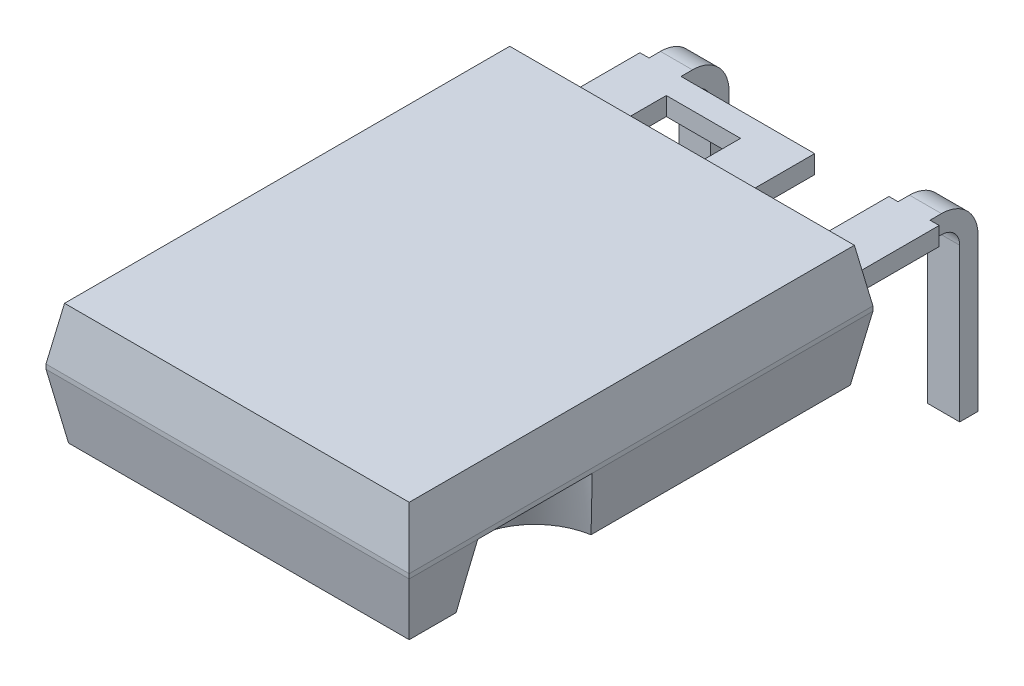
from build123d import *

# Parameters (mm, degrees)
SKETCH_3_W          = 15.9
SKETCH_3_H          = 5.3
EXTRUDE_1_DEPTH     = 20.3
SKETCH_4_W          = 2.2
SKETCH_4_H          = 0.8
EXTRUDE_2_DEPTH     = 4.3
SKETCH_6_W          = 1.4
SKETCH_6_H          = 0.8
EXTRUDE_3_DEPTH     = 10.5
SKETCH_7_R          = 1.8
CUT_EXTRUDE_1_DEPTH = 2.8
SKETCH_8_R          = 1
CUT_EXTRUDE_2_DEPTH = 0.1
CHAMFER_1_SIZE      = 2.8
CHAMFER_1_SIZE_2    = 0.493715546
CHAMFER_2_SIZE      = 0.405552056
CHAMFER_2_SIZE_2    = 2.3
SKETCH_9_W          = 1.4
SKETCH_9_H          = 0.8
CUT_EXTRUDE_3_DEPTH = 10.5
SKETCH_10_W         = 1.045125196
SKETCH_10_H         = 0.8
EXTRUDE_4_DEPTH     = 3.25
SKETCH_11_W         = 1.4
SKETCH_11_H         = 0.8
EXTRUDE_5_DEPTH     = 7.5
SKETCH_12_W         = 1.4
SKETCH_12_H         = 0.8
CUT_EXTRUDE_4_DEPTH = 8.4
FILLET_1_R          = 0.8
FILLET_2_R          = 1.6
SKETCH_13_R         = 0.177871301
CUT_EXTRUDE_5_DEPTH = 4


with BuildPart() as part:
    # Эскиз3 → Вытянуть1 (new body)
    with BuildSketch(Plane.XY.offset(4.3)):
        with Locations((0, -0.15)):
            Rectangle(SKETCH_3_W, SKETCH_3_H)
    extrude(amount=EXTRUDE_1_DEPTH)

    # Эскиз4 → Вытянуть2 (add)
    with BuildSketch(Plane.XY):
        Rectangle(SKETCH_4_W, SKETCH_4_H)
        with Locations((-5.45, 0)):
            Rectangle(SKETCH_4_W, SKETCH_4_H)
        with Locations((5.45, 0)):
            Rectangle(SKETCH_4_W, SKETCH_4_H)
    extrude(amount=EXTRUDE_2_DEPTH)

    # Эскиз6 → Вытянуть3 (add)
    with BuildSketch(Plane.XY):
        Rectangle(SKETCH_6_W, SKETCH_6_H)
        with Locations((-5.45, 0)):
            Rectangle(SKETCH_6_W, SKETCH_6_H)
        with Locations((5.45, 0)):
            Rectangle(SKETCH_6_W, SKETCH_6_H)
    extrude(amount=-EXTRUDE_3_DEPTH)

    # Эскиз7 → Вырез-Вытянуть1 (cut)
    with BuildSketch(Plane.XZ.offset(2.8)):
        with Locations((0, 19.1)):
            Circle(SKETCH_7_R)
        with BuildLine():
            Line((7.95, 16.6), (7.95, 21.6))
            ThreePointArc((7.95, 21.6), (5.45, 19.1), (7.95, 16.6))
        make_face()
        with BuildLine():
            Line((-7.95, 16.6), (-7.95, 21.6))
            ThreePointArc((-7.95, 21.6), (-5.45, 19.1), (-7.95, 16.6))
        make_face()
    extrude(amount=-CUT_EXTRUDE_1_DEPTH, mode=Mode.SUBTRACT)

    # Эскиз8 → Вырез-Вытянуть2 (cut)
    with BuildSketch(Plane.XZ.offset(2.8)):
        with Locations((-5, 7)):
            Circle(SKETCH_8_R)
    extrude(amount=-CUT_EXTRUDE_2_DEPTH, mode=Mode.SUBTRACT)

    # Фаска1
    # the kernel refuses this chamfer: 2.8, 0.493715546 mm, written as the material it takes off along each edge
    with BuildSketch(Plane(origin=(15.22590863, -2.8, 4.3), x_dir=(0, 0.9999776716360547, -0.006682531656101734), z_dir=(-1, 0, 0))) as chamfer_1_piece_1_section:
        Polygon((CHAMFER_1_SIZE * 0.999977671636, -CHAMFER_1_SIZE * 0.0066825316561), (-CHAMFER_1_SIZE_2 * 0.00668253165588, -CHAMFER_1_SIZE_2 * 0.999977671603), (0, 0), align=None)
    chamfer_1_piece_1 = extrude(amount=30.45181726, mode=Mode.PRIVATE)
    chamfer_1_piece_1 = split(chamfer_1_piece_1, bisect_by=Plane(origin=(6.55, -0.266666667, 4.323510264), z_dir=(1, 0, 0)), keep=Keep.TOP, mode=Mode.PRIVATE)
    add(chamfer_1_piece_1, mode=Mode.SUBTRACT)
    with BuildSketch(Plane(origin=(15.22590863, -2.8, 4.3), x_dir=(0, 0.9999776716360547, -0.006682531656101734), z_dir=(-1, 0, 0))) as chamfer_1_piece_2_section:
        Polygon((CHAMFER_1_SIZE * 0.999977671636, -CHAMFER_1_SIZE * 0.0066825316561), (-CHAMFER_1_SIZE_2 * 0.00668253165588, -CHAMFER_1_SIZE_2 * 0.999977671603), (0, 0), align=None)
    chamfer_1_piece_2 = extrude(amount=30.45181726, mode=Mode.PRIVATE)
    chamfer_1_piece_2 = split(chamfer_1_piece_2, bisect_by=Plane(origin=(5.45, -0.4, 4.467510632), z_dir=(0, -1, 0)), keep=Keep.TOP, mode=Mode.PRIVATE)
    add(chamfer_1_piece_2, mode=Mode.SUBTRACT)
    with BuildSketch(Plane(origin=(15.22590863, -2.8, 4.3), x_dir=(0, 0.9999776716360547, -0.006682531656101734), z_dir=(-1, 0, 0))) as chamfer_1_piece_3_section:
        Polygon((CHAMFER_1_SIZE * 0.999977671636, -CHAMFER_1_SIZE * 0.0066825316561), (-CHAMFER_1_SIZE_2 * 0.00668253165588, -CHAMFER_1_SIZE_2 * 0.999977671603), (0, 0), align=None)
    chamfer_1_piece_3 = extrude(amount=30.45181726, mode=Mode.PRIVATE)
    chamfer_1_piece_3 = split(chamfer_1_piece_3, bisect_by=Plane(origin=(4.35, -0.266666667, 4.323510264), z_dir=(-1, 0, 0)), keep=Keep.TOP, mode=Mode.PRIVATE)
    chamfer_1_piece_3 = split(chamfer_1_piece_3, bisect_by=Plane(origin=(1.1, -0.266666667, 4.323510264), z_dir=(1, 0, 0)), keep=Keep.TOP, mode=Mode.PRIVATE)
    add(chamfer_1_piece_3, mode=Mode.SUBTRACT)
    with BuildSketch(Plane(origin=(15.22590863, -2.8, 4.3), x_dir=(0, 0.9999776716360547, -0.006682531656101734), z_dir=(-1, 0, 0))) as chamfer_1_piece_4_section:
        Polygon((CHAMFER_1_SIZE * 0.999977671636, -CHAMFER_1_SIZE * 0.0066825316561), (-CHAMFER_1_SIZE_2 * 0.00668253165588, -CHAMFER_1_SIZE_2 * 0.999977671603), (0, 0), align=None)
    chamfer_1_piece_4 = extrude(amount=30.45181726, mode=Mode.PRIVATE)
    chamfer_1_piece_4 = split(chamfer_1_piece_4, bisect_by=Plane(origin=(-4.35, -0.266666667, 4.323510264), z_dir=(1, 0, 0)), keep=Keep.TOP, mode=Mode.PRIVATE)
    chamfer_1_piece_4 = split(chamfer_1_piece_4, bisect_by=Plane(origin=(-1.1, -0.266666667, 4.323510264), z_dir=(-1, 0, 0)), keep=Keep.TOP, mode=Mode.PRIVATE)
    add(chamfer_1_piece_4, mode=Mode.SUBTRACT)
    with BuildSketch(Plane(origin=(15.22590863, -2.8, 4.3), x_dir=(0, 0.9999776716360547, -0.006682531656101734), z_dir=(-1, 0, 0))) as chamfer_1_piece_5_section:
        Polygon((CHAMFER_1_SIZE * 0.999977671636, -CHAMFER_1_SIZE * 0.0066825316561), (-CHAMFER_1_SIZE_2 * 0.00668253165588, -CHAMFER_1_SIZE_2 * 0.999977671603), (0, 0), align=None)
    chamfer_1_piece_5 = extrude(amount=30.45181726, mode=Mode.PRIVATE)
    chamfer_1_piece_5 = split(chamfer_1_piece_5, bisect_by=Plane(origin=(-6.55, -0.266666667, 4.323510264), z_dir=(-1, 0, 0)), keep=Keep.TOP, mode=Mode.PRIVATE)
    add(chamfer_1_piece_5, mode=Mode.SUBTRACT)
    with BuildSketch(Plane(origin=(-7.95, -2.8, -2.97590863), x_dir=(-0.006682531656101734, 0.9999776716360547, 0), z_dir=(0, 0, 1))) as chamfer_1_piece_6:
        Polygon((CHAMFER_1_SIZE * 0.999977671636, -CHAMFER_1_SIZE * 0.0066825316561), (-CHAMFER_1_SIZE_2 * 0.00668253165588, -CHAMFER_1_SIZE_2 * 0.999977671603), (0, 0), align=None)
    extrude(amount=26.85181726, mode=Mode.SUBTRACT)
    with BuildSketch(Plane(origin=(-7.95, -2.8, 14.32409137), x_dir=(-0.006682531656101734, 0.9999776716360547, 0), z_dir=(0, 0, 1))) as chamfer_1_piece_7:
        Polygon((CHAMFER_1_SIZE * 0.999977671636, -CHAMFER_1_SIZE * 0.0066825316561), (-CHAMFER_1_SIZE_2 * 0.00668253165588, -CHAMFER_1_SIZE_2 * 0.999977671603), (0, 0), align=None)
    extrude(amount=17.55181726, mode=Mode.SUBTRACT)
    with BuildSketch(Plane(origin=(-7.95, -2.8, 19.1), x_dir=(-0.9999950652018581, 0, 0.0031415874858794286), z_dir=(-0.0031415874858794286, 0, -0.9999950652018581))) as chamfer_1_piece_8:
        Polygon((2.5 + CHAMFER_1_SIZE_2, 0), (2.5, CHAMFER_1_SIZE), (2.5, 0), align=None)
    revolve(axis=Axis((-7.95, -2.8, 19.1), (0, 1, 0)), revolution_arc=359.64, mode=Mode.SUBTRACT)
    with BuildSketch(Plane(origin=(15.22590863, -2.8, 24.6), x_dir=(0, 0.9999776716360547, 0.006682531656101123), z_dir=(-1, 0, 0))) as chamfer_1_piece_9:
        Polygon((CHAMFER_1_SIZE * 0.999977671636, CHAMFER_1_SIZE * 0.0066825316561), (-CHAMFER_1_SIZE_2 * 0.00668253165588, CHAMFER_1_SIZE_2 * 0.999977671603), (0, 0), align=None)
    extrude(amount=30.45181726, mode=Mode.SUBTRACT)
    with BuildSketch(Plane(origin=(7.95, -2.8, 14.32409137), x_dir=(-0.9776715712462587, -0.21013876076743054, 0), z_dir=(0, 0, 1))) as chamfer_1_piece_10:
        Polygon((CHAMFER_1_SIZE_2 * 0.977671571214, -CHAMFER_1_SIZE_2 * 0.21013876076), (-CHAMFER_1_SIZE * 0.210138760767, -CHAMFER_1_SIZE * 0.977671571246), (0, 0), align=None)
    extrude(amount=17.55181726, mode=Mode.SUBTRACT)
    with BuildSketch(Plane(origin=(7.95, -2.8, -2.97590863), x_dir=(-0.9776715712462587, -0.21013876076743054, 0), z_dir=(0, 0, 1))) as chamfer_1_piece_11:
        Polygon((CHAMFER_1_SIZE_2 * 0.977671571214, -CHAMFER_1_SIZE_2 * 0.21013876076), (-CHAMFER_1_SIZE * 0.210138760767, -CHAMFER_1_SIZE * 0.977671571246), (0, 0), align=None)
    extrude(amount=26.85181726, mode=Mode.SUBTRACT)
    with BuildSketch(Plane(origin=(7.95, -2.8, 19.1), x_dir=(0.9999950652018581, 0, 0.0031415874858794286), z_dir=(0.0031415874858794286, 0, -0.9999950652018581))) as chamfer_1_piece_12:
        Polygon((2.5 + CHAMFER_1_SIZE_2, 0), (2.5, -CHAMFER_1_SIZE), (2.5, 0), align=None)
    revolve(axis=Axis((7.95, -2.8, 19.1), (0, -1, 0)), revolution_arc=359.64, mode=Mode.SUBTRACT)

    # Фаска2
    # the kernel refuses this chamfer: 2.3, 0.405552056 mm, written as the material it takes off along each edge
    with BuildSketch(Plane(origin=(7.95, 2.5, -1.676639232), x_dir=(-0.9776715712462586, 0.21013876076743143, 0), z_dir=(0, 0, 1))) as chamfer_2_piece_1:
        Polygon((CHAMFER_2_SIZE * 0.977671570353, CHAMFER_2_SIZE * 0.210138760575), (-CHAMFER_2_SIZE_2 * 0.210138760767, CHAMFER_2_SIZE_2 * 0.977671571246), (0, 0), align=None)
    extrude(amount=32.253278464, mode=Mode.SUBTRACT)
    with BuildSketch(Plane(origin=(-13.926639232, 2.5, 24.6), x_dir=(0, -0.9999776716360546, 0.0066825316561023975), z_dir=(1, 0, 0))) as chamfer_2_piece_2:
        Polygon((CHAMFER_2_SIZE_2 * 0.999977671636, CHAMFER_2_SIZE_2 * 0.0066825316561), (-CHAMFER_2_SIZE * 0.00668253165, CHAMFER_2_SIZE * 0.999977670722), (0, 0), align=None)
    extrude(amount=27.853278464, mode=Mode.SUBTRACT)
    with BuildSketch(Plane(origin=(-7.95, 2.5, -1.676639232), x_dir=(-0.006682531656101655, -0.9999776716360548, 0), z_dir=(0, 0, 1))) as chamfer_2_piece_3:
        Polygon((CHAMFER_2_SIZE_2 * 0.999977671636, CHAMFER_2_SIZE_2 * 0.0066825316561), (-CHAMFER_2_SIZE * 0.00668253165, CHAMFER_2_SIZE * 0.999977670722), (0, 0), align=None)
    extrude(amount=32.253278464, mode=Mode.SUBTRACT)
    with BuildSketch(Plane(origin=(-13.926639232, 2.5, 4.3), x_dir=(0, -0.9999776716360546, -0.006682531656101654), z_dir=(1, 0, 0))) as chamfer_2_piece_4_section:
        Polygon((CHAMFER_2_SIZE_2 * 0.999977671636, -CHAMFER_2_SIZE_2 * 0.0066825316561), (-CHAMFER_2_SIZE * 0.00668253165, -CHAMFER_2_SIZE * 0.999977670722), (0, 0), align=None)
    chamfer_2_piece_4 = extrude(amount=27.853278464, mode=Mode.PRIVATE)
    chamfer_2_piece_4 = split(chamfer_2_piece_4, bisect_by=Plane(origin=(-6.55, 0.333333333, 4.311755132), z_dir=(-1, 0, 0)), keep=Keep.TOP, mode=Mode.PRIVATE)
    add(chamfer_2_piece_4, mode=Mode.SUBTRACT)
    with BuildSketch(Plane(origin=(-13.926639232, 2.5, 4.3), x_dir=(0, -0.9999776716360546, -0.006682531656101654), z_dir=(1, 0, 0))) as chamfer_2_piece_5_section:
        Polygon((CHAMFER_2_SIZE_2 * 0.999977671636, -CHAMFER_2_SIZE_2 * 0.0066825316561), (-CHAMFER_2_SIZE * 0.00668253165, -CHAMFER_2_SIZE * 0.999977670722), (0, 0), align=None)
    chamfer_2_piece_5 = extrude(amount=27.853278464, mode=Mode.PRIVATE)
    chamfer_2_piece_5 = split(chamfer_2_piece_5, bisect_by=Plane(origin=(-5.45, 0.4, 4.436124429), z_dir=(0, 1, 0)), keep=Keep.TOP, mode=Mode.PRIVATE)
    add(chamfer_2_piece_5, mode=Mode.SUBTRACT)
    with BuildSketch(Plane(origin=(-13.926639232, 2.5, 4.3), x_dir=(0, -0.9999776716360546, -0.006682531656101654), z_dir=(1, 0, 0))) as chamfer_2_piece_6_section:
        Polygon((CHAMFER_2_SIZE_2 * 0.999977671636, -CHAMFER_2_SIZE_2 * 0.0066825316561), (-CHAMFER_2_SIZE * 0.00668253165, -CHAMFER_2_SIZE * 0.999977670722), (0, 0), align=None)
    chamfer_2_piece_6 = extrude(amount=27.853278464, mode=Mode.PRIVATE)
    chamfer_2_piece_6 = split(chamfer_2_piece_6, bisect_by=Plane(origin=(-4.35, 0.333333333, 4.311755132), z_dir=(1, 0, 0)), keep=Keep.TOP, mode=Mode.PRIVATE)
    chamfer_2_piece_6 = split(chamfer_2_piece_6, bisect_by=Plane(origin=(-1.1, 0.333333333, 4.311755132), z_dir=(-1, 0, 0)), keep=Keep.TOP, mode=Mode.PRIVATE)
    add(chamfer_2_piece_6, mode=Mode.SUBTRACT)
    with BuildSketch(Plane(origin=(-13.926639232, 2.5, 4.3), x_dir=(0, -0.9999776716360546, -0.006682531656101654), z_dir=(1, 0, 0))) as chamfer_2_piece_7_section:
        Polygon((CHAMFER_2_SIZE_2 * 0.999977671636, -CHAMFER_2_SIZE_2 * 0.0066825316561), (-CHAMFER_2_SIZE * 0.00668253165, -CHAMFER_2_SIZE * 0.999977670722), (0, 0), align=None)
    chamfer_2_piece_7 = extrude(amount=27.853278464, mode=Mode.PRIVATE)
    chamfer_2_piece_7 = split(chamfer_2_piece_7, bisect_by=Plane(origin=(1.1, 0.333333333, 4.311755132), z_dir=(1, 0, 0)), keep=Keep.TOP, mode=Mode.PRIVATE)
    chamfer_2_piece_7 = split(chamfer_2_piece_7, bisect_by=Plane(origin=(4.35, 0.333333333, 4.311755132), z_dir=(-1, 0, 0)), keep=Keep.TOP, mode=Mode.PRIVATE)
    add(chamfer_2_piece_7, mode=Mode.SUBTRACT)
    with BuildSketch(Plane(origin=(-13.926639232, 2.5, 4.3), x_dir=(0, -0.9999776716360546, -0.006682531656101654), z_dir=(1, 0, 0))) as chamfer_2_piece_8_section:
        Polygon((CHAMFER_2_SIZE_2 * 0.999977671636, -CHAMFER_2_SIZE_2 * 0.0066825316561), (-CHAMFER_2_SIZE * 0.00668253165, -CHAMFER_2_SIZE * 0.999977670722), (0, 0), align=None)
    chamfer_2_piece_8 = extrude(amount=27.853278464, mode=Mode.PRIVATE)
    chamfer_2_piece_8 = split(chamfer_2_piece_8, bisect_by=Plane(origin=(6.55, 0.333333333, 4.311755132), z_dir=(1, 0, 0)), keep=Keep.TOP, mode=Mode.PRIVATE)
    add(chamfer_2_piece_8, mode=Mode.SUBTRACT)

    # Эскиз9 → Вырез-Вытянуть3 (cut)
    with BuildSketch(Plane(origin=(0, 0, -10.5), x_dir=(-1, 0, 0), z_dir=(0, 0, -1))):
        Rectangle(SKETCH_9_W, SKETCH_9_H)
    extrude(amount=-CUT_EXTRUDE_3_DEPTH, mode=Mode.SUBTRACT)

    # Эскиз10 → Вытянуть4 (add)
    with BuildSketch(Plane.ZY.offset(1.1)):
        with Locations((0.522562598, 0)):
            Rectangle(SKETCH_10_W, SKETCH_10_H)
    extrude(amount=EXTRUDE_4_DEPTH)

    # Эскиз11 → Вытянуть5 (add)
    with BuildSketch(Plane.XZ.offset(0.4)):
        with Locations((-5.45, -1.7)):
            Rectangle(SKETCH_11_W, SKETCH_11_H)
        with Locations((5.45, -1.7)):
            Rectangle(SKETCH_11_W, SKETCH_11_H)
    extrude(amount=EXTRUDE_5_DEPTH)

    # Эскиз12 → Вырез-Вытянуть4 (cut)
    with BuildSketch(Plane(origin=(0, 0, -10.5), x_dir=(-1, 0, 0), z_dir=(0, 0, -1))):
        with Locations((5.45, 0)):
            Rectangle(SKETCH_12_W, SKETCH_12_H)
        with Locations((-5.45, 0)):
            Rectangle(SKETCH_12_W, SKETCH_12_H)
    extrude(amount=-CUT_EXTRUDE_4_DEPTH, mode=Mode.SUBTRACT)

    # Скругление1
    fillet_1_edges = [part.edges().sort_by_distance(p)[0] for p in [
        (5.45, -0.4, -1.3),
        (-5.45, -0.4, -1.3),
    ]]
    fillet(fillet_1_edges, radius=FILLET_1_R)

    # Скругление2
    fillet_2_edges = [part.edges().sort_by_distance(p)[0] for p in [
        (5.45, 0.4, -2.1),
        (-5.45, 0.4, -2.1),
    ]]
    fillet(fillet_2_edges, radius=FILLET_2_R)

    # Эскиз13 → Вырез-Вытянуть5 (cut)
    with BuildSketch(Plane.XZ.offset(7.9)):
        with Locations((-5.45, -1.7)):
            Circle(SKETCH_13_R)
    extrude(amount=-CUT_EXTRUDE_5_DEPTH, mode=Mode.SUBTRACT)


solid = part.part
